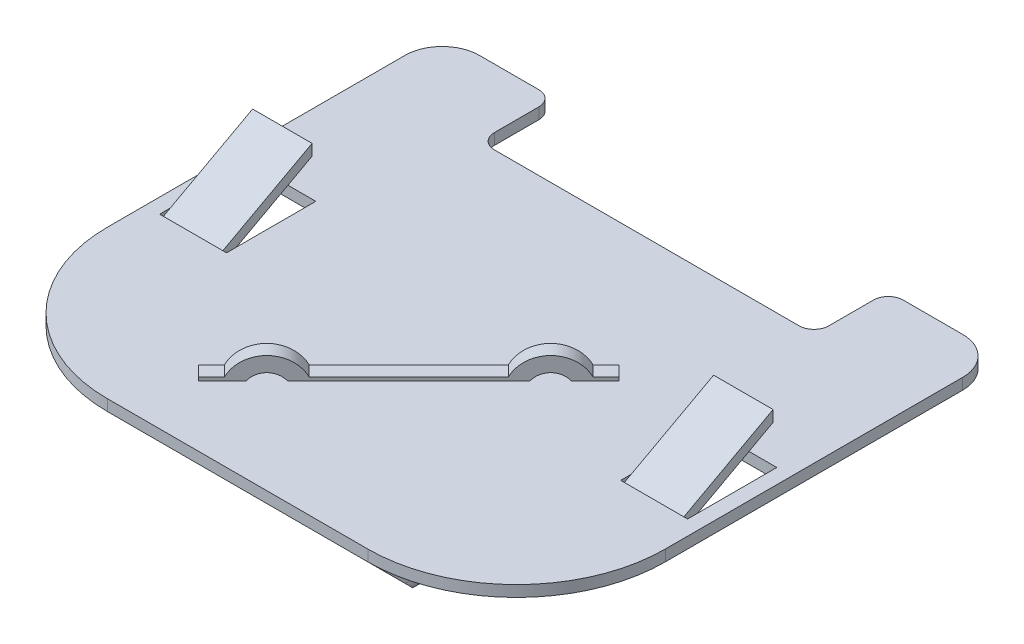
from build123d import *

# Parameters (mm, degrees)
SKETCH1_W               = 15
SKETCH1_H               = 13
BASE_DEPTH              = 0.3
SKETCH7_W               = 1.8
SKETCH7_H               = 2.4
LOCKING_CLAMP_CUT_DEPTH = 10.92924972
LOCKING_CLAMP_DEPTH     = 0.8
SPRING_CLASP_DEPTH      = 0.2
WIRE_CONNECTION_DEPTH   = 1
SKETCH14_W              = 9
SKETCH14_H              = 2
BOTTOM_SLOT_CUT_DEPTH   = 11.816191566
TS_F_R                  = 1
BS_F_R                  = 4
WC_F_R                  = 0.5
BSC_F_R                 = 0.4


with BuildPart() as part:
    # Sketch1 → BASE (new body)
    with BuildSketch(Plane(origin=(0, 0, 0), x_dir=(1, 0, 0), z_dir=(0, 1, 0))):
        Rectangle(SKETCH1_W, SKETCH1_H)
    extrude(amount=BASE_DEPTH)

    # Sketch7 → LOCKING CLAMP CUT (cut, through all)
    with BuildSketch(Plane(origin=(0, 0.3, 0), x_dir=(1, 0, 0), z_dir=(0, 1, 0))):
        with Locations((6.2, -0.3)):
            Rectangle(SKETCH7_W, SKETCH7_H)
    locking_clamp_cut = extrude(amount=-LOCKING_CLAMP_CUT_DEPTH, mode=Mode.SUBTRACT)

    # Sketch9 → LOCKING CLAMP (add, symmetric)
    with BuildSketch(Plane.ZY.offset(-6.2)):
        Polygon((1.5, 0.3), (-0.9, 1.6), (-0.9, 1.3), (1.5, 0), align=None)
    locking_clamp = extrude(amount=LOCKING_CLAMP_DEPTH, both=True)

    # LC M: LOCKING CLAMP CUT, LOCKING CLAMP across plane
    add(locking_clamp_cut.mirror(Plane(origin=(0, 0, 0), x_dir=(0, 0, 1), z_dir=(1, 0, 0))), mode=Mode.SUBTRACT)
    add(locking_clamp.mirror(Plane(origin=(0, 0, 0), x_dir=(0, 0, 1), z_dir=(1, 0, 0))))

    # Sketch11 → SPRING CLASP (add, symmetric)
    with BuildSketch(Plane(origin=(0.95, 0, 0.95), x_dir=(-0.7071067811865436, 0, 0.7071067811865516), z_dir=(-0.7071067811865516, 0, -0.7071067811865436))):
        with BuildLine():
            Line((5.343502884, 0), (4.635110863, 0))
            ThreePointArc((4.635110863, 0), (4.57056114, 0.023623738), (4.536509533, 0.083333333))
            ThreePointArc((4.536509533, 0.083333333), (4.043502884, 0.5), (3.550496236, 0.083333333))
            ThreePointArc((3.550496236, 0.083333333), (3.516444628, 0.023623738), (3.451894906, 0))
            Line((3.451894906, 0), (-0.764889137, 0))
            ThreePointArc((-0.764889137, 0), (-0.82943886, 0.023623738), (-0.863490467, 0.083333333))
            ThreePointArc((-0.863490467, 0.083333333), (-1.356497116, 0.5), (-1.849503764, 0.083333333))
            ThreePointArc((-1.849503764, 0.083333333), (-1.883555372, 0.023623738), (-1.948105094, 0))
            Line((-1.948105094, 0), (-2.656497116, 0))
            Line((-2.656497116, 0), (-2.656497116, 0.4))
            Line((-2.656497116, 0.4), (-2.162722891, 0.4))
            ThreePointArc((-2.162722891, 0.4), (-1.356497116, 0.9), (-0.550271341, 0.4))
            Line((-0.550271341, 0.4), (3.237277109, 0.4))
            ThreePointArc((3.237277109, 0.4), (4.043502884, 0.9), (4.849728659, 0.4))
            Line((4.849728659, 0.4), (5.343502884, 0.4))
            Line((5.343502884, 0.4), (5.343502884, 0))
        make_face()
    extrude(amount=SPRING_CLASP_DEPTH, both=True)

    # Sketch13 → WIRE CONNECTION (add, symmetric)
    with BuildSketch(Plane(origin=(0, 0, 0), x_dir=(0, 0, -1), z_dir=(1, 0, 0))):
        Polygon((-6.5, 0), (-2.5, -4), (-2.2, -4), (-6.2, 0), align=None)
    extrude(amount=WIRE_CONNECTION_DEPTH, both=True)

    # Sketch14 → BOTTOM SLOT CUT (cut, through all)
    with BuildSketch(Plane(origin=(0, 0.3, 0), x_dir=(1, 0, 0), z_dir=(0, 1, 0))):
        with Locations((0, 5.5)):
            Rectangle(SKETCH14_W, SKETCH14_H)
    extrude(amount=-BOTTOM_SLOT_CUT_DEPTH, mode=Mode.SUBTRACT)

    # TS F
    ts_f_edges = [part.edges().sort_by_distance(p)[0] for p in [
        (-7.5, 0.15, -6.5),
        (7.5, 0.15, -6.5),
    ]]
    fillet(ts_f_edges, radius=TS_F_R)

    # BS F
    bs_f_edges = [part.edges().sort_by_distance(p)[0] for p in [
        (7.5, 0.15, 6.5),
        (-7.5, 0.15, 6.5),
    ]]
    fillet(bs_f_edges, radius=BS_F_R)

    # WC F
    # the kernel refuses this fillet: 0.5 mm, written as the material it takes off along each edge
    with BuildSketch(Plane(origin=(-1, -4, 3.75), x_dir=(0, 1, 0), z_dir=(0, 0, -1))) as wc_f_piece_1:
        with BuildLine():
            CenterArc((WC_F_R, WC_F_R), WC_F_R, 180, 90)
            Line((0, WC_F_R), (0, 0))
            Line((0, 0), (WC_F_R, 0))
        make_face()
    extrude(amount=2.8, mode=Mode.SUBTRACT)
    with BuildSketch(Plane(origin=(1, -4, 3.75), x_dir=(0, 1, 0), z_dir=(0, 0, -1))) as wc_f_piece_2:
        with BuildLine():
            CenterArc((WC_F_R, -WC_F_R), WC_F_R, 90, 90)
            Line((0, -WC_F_R), (0, 0))
            Line((0, 0), (WC_F_R, 0))
        make_face()
    extrude(amount=2.8, mode=Mode.SUBTRACT)

    # BSC F
    bsc_f_edges = [part.edges().sort_by_distance(p)[0] for p in [
        (4.5, 0.15, -6.5),
        (-4.5, 0.15, -6.5),
        (4.5, 0.15, -4.5),
        (-4.5, 0.15, -4.5),
    ]]
    fillet(bsc_f_edges, radius=BSC_F_R)


solid = part.part
